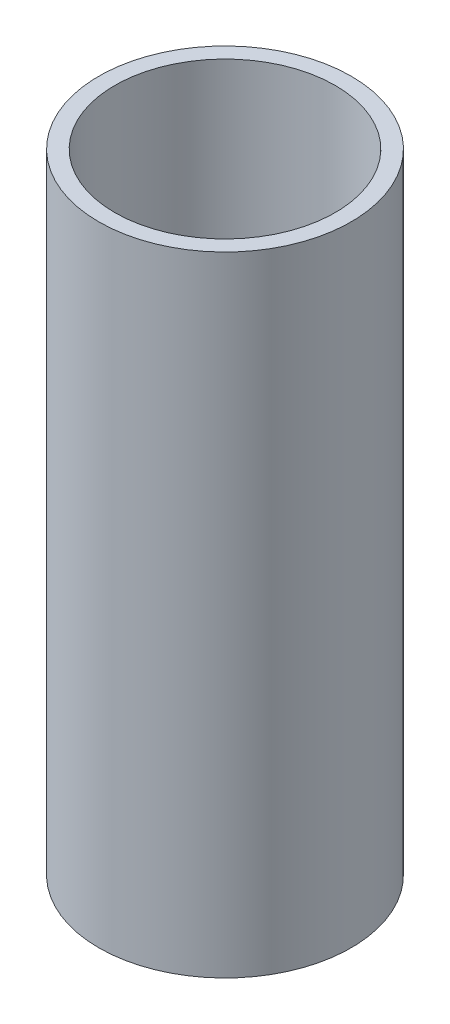
from build123d import *

# Parameters (mm, degrees)
SKETCH1_R           = 7.025
SKETCH1_R_2         = 6.135
BOSS_EXTRUDE1_DEPTH = 35


with BuildPart() as part:
    # Sketch1 → Boss-Extrude1 (new body)
    with BuildSketch(Plane(origin=(0, 0, 0), x_dir=(1, 0, 0), z_dir=(0, 1, 0))):
        Circle(SKETCH1_R)
        Circle(SKETCH1_R_2, mode=Mode.SUBTRACT)
    extrude(amount=BOSS_EXTRUDE1_DEPTH)


solid = part.part
